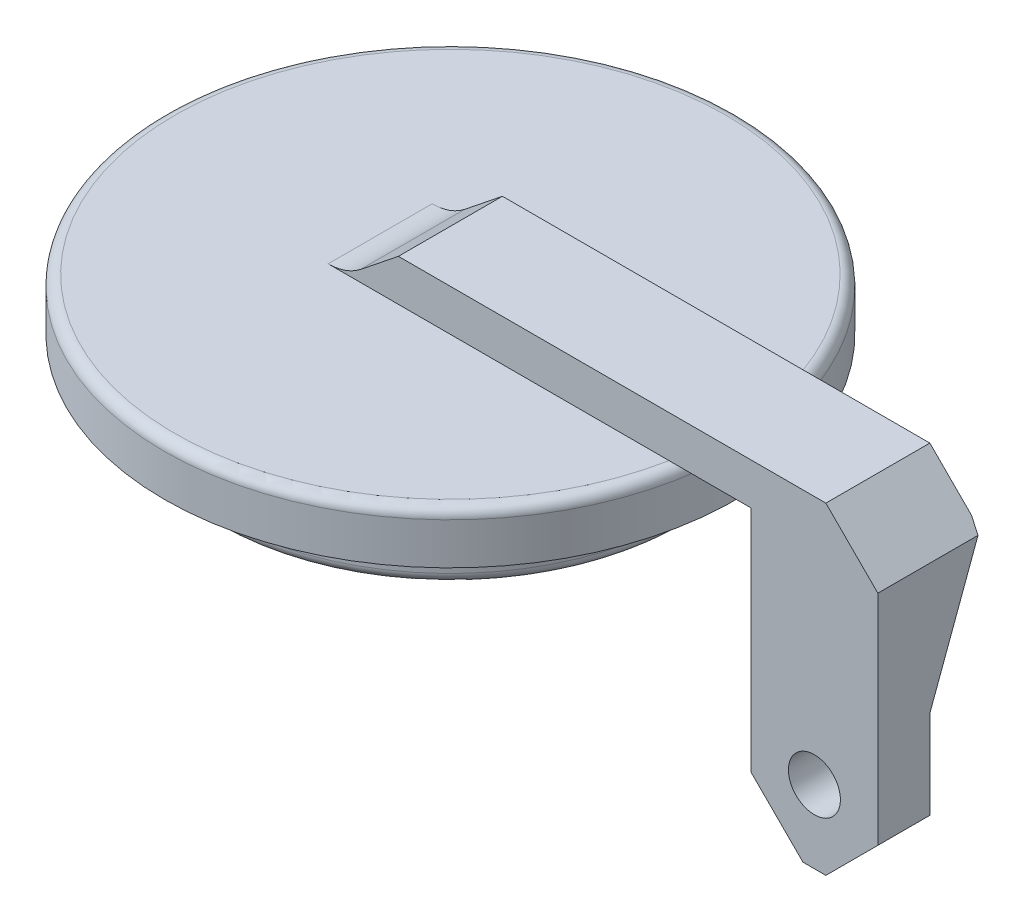
from build123d import *

# Parameters (mm, degrees)
FILLET1_R           = 1
BOSS_EXTRUDE2_DEPTH = 5
SKETCH14_W          = 12.2
SKETCH14_H          = 27
SKETCH14_R          = 2.5
BOSS_EXTRUDE6_DEPTH = 5
BOSS_EXTRUDE7_DEPTH = 12.2
FILLET2_R           = 5
CHAMFER1_SIZE       = 5


with BuildPart() as part:
    # Sketch2 → Revolve1 (revolve)
    with BuildSketch(Plane.XY):
        Polygon((0, 0), (22.5, 0), (22.5, 5), (27.5, 5), (27.5, 10), (0, 10), align=None)
    revolve(axis=Axis((0, 10, 0), (0, -1, 0)))

    # Fillet1
    fillet1_edges = [part.edges().sort_by_distance(p)[0] for p in [
        (-27.5, 10, 0),
        (-22.5, 5, 0),
        (-22.5, 0, 0),
    ]]
    fillet(fillet1_edges, radius=FILLET1_R)

    # Sketch5 → Boss-Extrude2 (add, symmetric)
    with BuildSketch(Plane.XY):
        Polygon((0, 10), (46.1, 10), (46.1, 14), (0, 14), (-5, 10), align=None)
    extrude(amount=BOSS_EXTRUDE2_DEPTH, both=True)

    # Sketch14 → Boss-Extrude6 (add)
    with BuildSketch(Plane.XY):
        with Locations((40, -3.5)):
            Rectangle(SKETCH14_W, SKETCH14_H)
        with Locations((40, -10)):
            Circle(SKETCH14_R, mode=Mode.SUBTRACT)
    extrude(amount=BOSS_EXTRUDE6_DEPTH)

    # Sketch15 → Boss-Extrude7 (add)
    with BuildSketch(Plane(origin=(46.1, 0, 0), x_dir=(0, 0, -1), z_dir=(1, 0, 0))):
        Polygon((5, 10), (0, -3.5), (0, 10), align=None)
    extrude(amount=-BOSS_EXTRUDE7_DEPTH)

    # Fillet2
    fillet2_edges = [part.edges().sort_by_distance(p)[0] for p in [
        (-5, 10, 0),
    ]]
    fillet(fillet2_edges, radius=FILLET2_R)

    # Chamfer1
    chamfer1_edges = [part.edges().sort_by_distance(p)[0] for p in [
        (46.1, 14, 0),
        (33.9, -17, 2.5),
        (46.1, -17, 2.5),
    ]]
    chamfer(chamfer1_edges, length=CHAMFER1_SIZE)


solid = part.part
